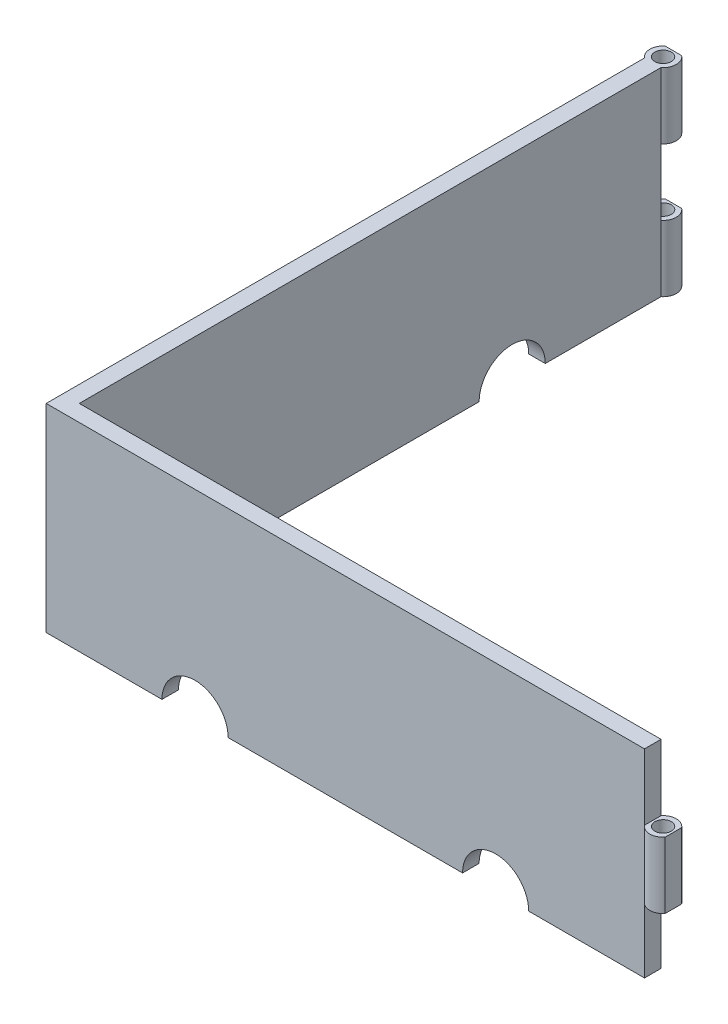
from build123d import *

# Parameters (mm, degrees)
BOSS_EXTRUDE1_DEPTH     = 60
SKETCH2_R               = 2.5
CUT_EXTRUDE1_DEPTH      = 50
CUT_EXTRUDE3_DEPTH      = 273.558250655
CUT_EXTRUDE3_DEPTH_BACK = 273.558250655
SKETCH4_W               = 7.122498999
SKETCH4_H               = 20
CUT_EXTRUDE4_DEPTH      = 269.864278029
CUT_EXTRUDE4_DEPTH_BACK = 269.864278029
CUT_EXTRUDE6_DEPTH      = 272.953727005
CUT_EXTRUDE6_DEPTH_BACK = 272.953727005
SKETCH6_W               = 8.505604829
SKETCH6_H               = 20
CUT_EXTRUDE7_DEPTH      = 272.953727005
CUT_EXTRUDE7_DEPTH_BACK = 272.953727005


with BuildPart() as part:
    # Sketch1 → Boss-Extrude1 (new body)
    with BuildSketch(Plane(origin=(0, 0, 0), x_dir=(1, 0, 0), z_dir=(0, 1, 0))):
        with BuildLine():
            Line((0, 0), (180, 0))
            Line((180, 0), (180.877501001, 0))
            ThreePointArc((180.877501001, 0), (188, 2.5), (180.877501001, 5))
            Line((180.877501001, 5), (180, 5))
            Line((180, 5), (5, 5))
            Line((5, 5), (5, 180))
            Line((5, 180), (5, 180.877501001))
            ThreePointArc((5, 180.877501001), (2.5, 188), (0, 180.877501001))
            Line((0, 180.877501001), (0, 180))
            Line((0, 180), (0, 0))
        make_face()
    extrude(amount=BOSS_EXTRUDE1_DEPTH)

    # Sketch2 → Cut-Extrude1 (cut)
    with BuildSketch(Plane(origin=(0, 60, 0), x_dir=(1, 0, 0), z_dir=(0, 1, 0))):
        with Locations((184, 2.5)):
            Circle(SKETCH2_R)
        with Locations((2.5, 184)):
            Circle(SKETCH2_R)
    extrude(amount=-CUT_EXTRUDE1_DEPTH, mode=Mode.SUBTRACT)

    # Sketch4 → Cut-Extrude3 (cut, two sides: drawn at the far end of the back side and taken through both)
    with BuildSketch(Plane.XY.offset(-CUT_EXTRUDE3_DEPTH_BACK)):
        with Locations((184.438750501, 10)):
            Rectangle(SKETCH4_W, SKETCH4_H)
        with Locations((184.438750501, 50)):
            Rectangle(SKETCH4_W, SKETCH4_H)
        with BuildLine():
            Line((35, 0), (55, 0))
            ThreePointArc((55, 0), (45, 10), (35, 0))
        make_face()
        with BuildLine():
            Line((125.877501001, 0), (145.877501001, 0))
            ThreePointArc((145.877501001, 0), (135.877501001, 10), (125.877501001, 0))
        make_face()
    extrude(amount=CUT_EXTRUDE3_DEPTH + CUT_EXTRUDE3_DEPTH_BACK, mode=Mode.SUBTRACT)

    # Sketch5 → Cut-Extrude4 (cut, two sides: drawn at the far end of the back side and taken through both)
    with BuildSketch(Plane(origin=(0, 40, 0), x_dir=(1, 0, 0), z_dir=(0, 1, 0)).offset(-CUT_EXTRUDE4_DEPTH_BACK)):
        with BuildLine():
            Line((187.122498999, 5), (187.122498999, 2.5))
            Line((187.122498999, 2.5), (187.122498999, 0))
            ThreePointArc((187.122498999, 0), (188, 2.5), (187.122498999, 5))
        make_face()
    extrude(amount=CUT_EXTRUDE4_DEPTH + CUT_EXTRUDE4_DEPTH_BACK, mode=Mode.SUBTRACT)

    # Sketch6 → Cut-Extrude6 (cut, two sides: drawn at the far end of the back side and taken through both)
    with BuildSketch(Plane.ZY.offset(-CUT_EXTRUDE6_DEPTH_BACK)):
        with BuildLine():
            Line((-55, 0), (-35, 0))
            ThreePointArc((-35, 0), (-45, 10), (-55, 0))
        make_face()
        with Locations((-185.130303416, 30)):
            Rectangle(SKETCH6_W, SKETCH6_H)
        with BuildLine():
            Line((-145.877501001, 0), (-125.877501001, 0))
            ThreePointArc((-125.877501001, 0), (-135.877501001, 10), (-145.877501001, 0))
        make_face()
    extrude(amount=CUT_EXTRUDE6_DEPTH + CUT_EXTRUDE6_DEPTH_BACK, mode=Mode.SUBTRACT)

    # Sketch7 → Cut-Extrude7 (cut, two sides: drawn at the far end of the back side and taken through both)
    with BuildSketch(Plane(origin=(0, 60, 0), x_dir=(1, 0, 0), z_dir=(0, 1, 0)).offset(-CUT_EXTRUDE7_DEPTH_BACK)):
        with BuildLine():
            ThreePointArc((5, 187.122498999), (2.5, 188), (0, 187.122498999))
            Line((0, 187.122498999), (2.5, 187.122498999))
            Line((2.5, 187.122498999), (5, 187.122498999))
        make_face()
    extrude(amount=CUT_EXTRUDE7_DEPTH + CUT_EXTRUDE7_DEPTH_BACK, mode=Mode.SUBTRACT)


solid = part.part
